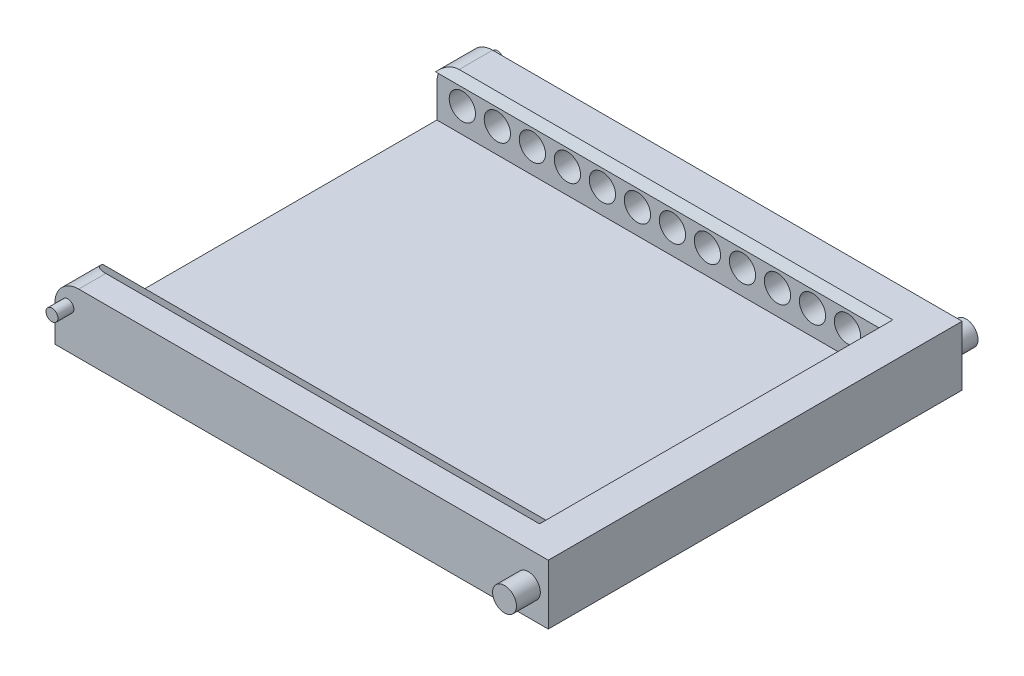
from build123d import *

# Parameters (mm, degrees)
SKETCH1_W               = 520
SKETCH1_H               = 75
SKETCH1_W_2             = 440
SKETCH1_H_2             = 60
BOSS_EXTRUDE1_DEPTH     = 10
BOSS_EXTRUDE2_DEPTH     = 575
SKETCH3_W               = 520
SKETCH3_H               = 75
BOSS_EXTRUDE3_DEPTH     = 35
CHAMFER1_SIZE           = 19
CHAMFER1_SIZE_2         = 10.969655115
FILLET1_R               = 30
SKETCH4_R               = 7.5
BOSS_EXTRUDE4_DEPTH     = 20
BOSS_EXTRUDE5_START     = 20
SKETCH5_R               = 7.5
BOSS_EXTRUDE5_DEPTH     = 20
SKETCH6_R               = 15
BOSS_EXTRUDE6_DEPTH     = 30
BOSS_EXTRUDE7_START     = 30
SKETCH7_R               = 15
BOSS_EXTRUDE7_DEPTH     = 30
CUT_EXTRUDE1_DEPTH      = 250
CUT_EXTRUDE1_DEPTH_BACK = 250
SKETCH8_R               = 16.5


with BuildPart() as part:
    # Sketch1 → Boss-Extrude1 (new body)
    with BuildSketch(Plane(origin=(0, 0, 0), x_dir=(0, 0, -1), z_dir=(1, 0, 0))):
        with Locations((0, 37.5)):
            Rectangle(SKETCH1_W, SKETCH1_H)
        with Locations((0, 34)):
            Rectangle(SKETCH1_W_2, SKETCH1_H_2, mode=Mode.SUBTRACT)
    extrude(amount=-BOSS_EXTRUDE1_DEPTH)

    # Sketch2 → Boss-Extrude2 (add)
    with BuildSketch(Plane.ZY.offset(10)):
        Polygon((260, 0), (260, 75), (207, 75), (207, 64), (220, 64), (220, 4), (-220, 4), (-220, 64), (-207, 64), (-207, 75), (-260, 75), (-260, 0), align=None)
    extrude(amount=BOSS_EXTRUDE2_DEPTH)

    # Sketch3 → Boss-Extrude3 (add)
    with BuildSketch(Plane(origin=(0, 0, 0), x_dir=(0, 0, -1), z_dir=(1, 0, 0))):
        with Locations((0, 37.5)):
            Rectangle(SKETCH3_W, SKETCH3_H)
    extrude(amount=BOSS_EXTRUDE3_DEPTH)

    # Chamfer1
    # the kernel refuses this chamfer: 19, 10.969655115 mm, written as the material it takes off along each edge
    with BuildSketch(Plane(origin=(-10, 75, 207), x_dir=(0, 0.01932676561270119, 0.9998132206222079), z_dir=(-1, 0, 0))) as chamfer1_piece_1:
        Polygon((CHAMFER1_SIZE * 0.999813220622, -CHAMFER1_SIZE * 0.0193267656127), (-CHAMFER1_SIZE_2 * 0.019326765612, -CHAMFER1_SIZE_2 * 0.999813220586), (0, 0), align=None)
    extrude(amount=624.154629338, mode=Mode.SUBTRACT)
    with BuildSketch(Plane(origin=(-10, 75, -207), x_dir=(0, 0.057893862402678804, -0.9983227437537922), z_dir=(-1, 0, 0))) as chamfer1_piece_2:
        Polygon((CHAMFER1_SIZE_2 * 0.998322743718, CHAMFER1_SIZE_2 * 0.0578938624006), (-CHAMFER1_SIZE * 0.0578938624027, CHAMFER1_SIZE * 0.998322743754), (0, 0), align=None)
    extrude(amount=624.154629338, mode=Mode.SUBTRACT)

    # Fillet1
    fillet1_edges = [part.edges().sort_by_distance(p)[0] for p in [
        (-585, 75, 243),
        (-585, 75, -238.984827557),
    ]]
    fillet(fillet1_edges, radius=FILLET1_R)

    # Sketch4 → Boss-Extrude4 (add)
    with BuildSketch(Plane.XY.offset(260)):
        with Locations((-568.68, 50)):
            Circle(SKETCH4_R)
    extrude(amount=BOSS_EXTRUDE4_DEPTH)

    # Sketch5 → Boss-Extrude5 (add)
    with BuildSketch(Plane(origin=(0, 0, -260), x_dir=(-1, 0, 0), z_dir=(0, 0, -1)).offset(BOSS_EXTRUDE5_START)):
        with Locations(Location((568.68, 50, 0), (0, 0, 180))):
            Circle(SKETCH5_R)
    extrude(amount=-BOSS_EXTRUDE5_DEPTH)

    # Sketch6 → Boss-Extrude6 (add)
    with BuildSketch(Plane.XY.offset(260)):
        with Locations((10, 35)):
            Circle(SKETCH6_R)
    extrude(amount=BOSS_EXTRUDE6_DEPTH)

    # Sketch7 → Boss-Extrude7 (add)
    with BuildSketch(Plane(origin=(0, 0, -260), x_dir=(-1, 0, 0), z_dir=(0, 0, -1)).offset(BOSS_EXTRUDE7_START)):
        with Locations(Location((-10, 35, 0), (0, 0, 180))):
            Circle(SKETCH7_R)
    extrude(amount=-BOSS_EXTRUDE7_DEPTH)

    # Sketch8 → Cut-Extrude1 (cut, two sides: drawn at the far end of the back side and taken through both)
    with BuildSketch(Plane.XY.offset(-CUT_EXTRUDE1_DEPTH_BACK)):
        with Locations(Location((-25, 35, 0), (0, 0, 180))):
            Circle(SKETCH8_R)
        with Locations(Location((-69, 35, 0), (0, 0, 180))):
            Circle(SKETCH8_R)
        with Locations(Location((-113, 35, 0), (0, 0, 180))):
            Circle(SKETCH8_R)
        with Locations(Location((-157, 35, 0), (0, 0, 180))):
            Circle(SKETCH8_R)
        with Locations(Location((-201, 35, 0), (0, 0, 180))):
            Circle(SKETCH8_R)
        with Locations(Location((-245, 35, 0), (0, 0, 180))):
            Circle(SKETCH8_R)
        with Locations(Location((-289, 35, 0), (0, 0, 180))):
            Circle(SKETCH8_R)
        with Locations(Location((-333, 35, 0), (0, 0, 180))):
            Circle(SKETCH8_R)
        with Locations(Location((-377, 35, 0), (0, 0, 180))):
            Circle(SKETCH8_R)
        with Locations(Location((-421, 35, 0), (0, 0, 180))):
            Circle(SKETCH8_R)
        with Locations(Location((-465, 35, 0), (0, 0, 180))):
            Circle(SKETCH8_R)
        with Locations(Location((-509, 35, 0), (0, 0, 180))):
            Circle(SKETCH8_R)
        with Locations(Location((-553, 35, 0), (0, 0, 180))):
            Circle(SKETCH8_R)
    extrude(amount=CUT_EXTRUDE1_DEPTH + CUT_EXTRUDE1_DEPTH_BACK, mode=Mode.SUBTRACT)


solid = part.part
